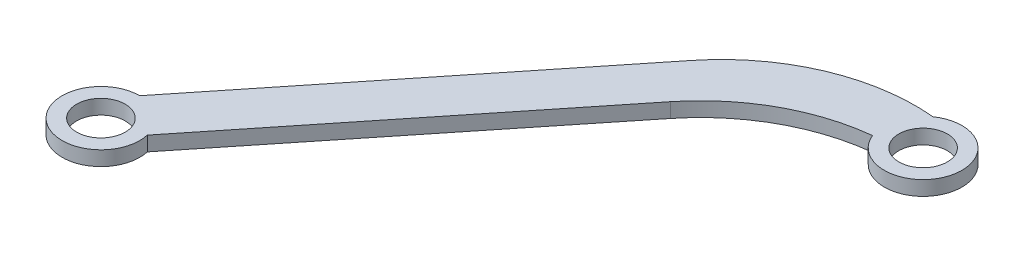
from build123d import *

# Parameters (mm, degrees)
EXTRUDE_1_DEPTH     = 3
FILLET_1_R          = 40
SKETCH_2_R          = 5
CUT_EXTRUDE_1_DEPTH = 5
SKETCH_3_R          = 5
CUT_EXTRUDE_2_DEPTH = 5


with BuildPart() as part:
    # 草图1 → 凸台-拉伸1 (new body)
    with BuildSketch(Plane(origin=(0, 0, 0), x_dir=(1, 0, 0), z_dir=(0, 1, 0))):
        with BuildLine():
            Line((-23.136391963, 12.14008034), (-4.550043431, 6.580053554))
            ThreePointArc((-4.550043431, 6.580053554), (7.664409986, -2.292775515), (-7.416012825, -3.000458929))
            Line((-7.416012825, -3.000458929), (-19.543612326, 0.627460668))
            Line((-19.543612326, 0.627460668), (-82.193752502, -77.622539332))
            ThreePointArc((-82.193752502, -77.622539332), (-95, -85.61753733), (-90, -71.372539332))
            Line((-90, -71.372539332), (-23.136391963, 12.14008034))
        make_face()
    extrude(amount=EXTRUDE_1_DEPTH)

    # 圆角1
    # the kernel refuses this fillet: 40 mm, written as the material it adds along each edge
    with BuildSketch(Plane(origin=(-19.543612326, 0, -0.627460668), x_dir=(0.9580512482944434, 0, 0.2865969393441921), z_dir=(0, 1, 0))) as fillet_1_piece_1:
        with BuildLine():
            CenterArc((28.245446023, -36.838167986), FILLET_1_R, 112.934019548, 45.038121995)
            Line((-8.834618101, -21.835873341), (-9.576219383, -21.535827448))
            Line((-9.576219383, -21.535827448), (-0.741601282, 0.300045893))
            Line((-0.741601282, 0.300045893), (0, 0.8))
            ThreePointArc((0, 0.8), (6.329306247, 0.8), (12.346875823, 0.73676336))
            Line((12.346875823, 0.73676336), (12.658612494, 0))
        make_face()
    extrude(amount=3)
    # the kernel refuses this fillet: 40 mm, written as the material it takes off along each edge
    with BuildSketch(Plane(origin=(-23.136391963, -65.299644029, -12.14008034), x_dir=(0.9580512482944434, 0, 0.2865969393441925), z_dir=(0, 1, 0))) as fillet_1_2_piece_1:
        with BuildLine():
            CenterArc((27.283619124, -39.215444523), FILLET_1_R, 101.366634115, 56.605507428)
            Line((-9.796444999, -24.213149878), (-10.538046282, -23.913103985))
            Line((-10.538046282, -23.913103985), (-0.741601282, 0.300045893))
            Line((-0.741601282, 0.300045893), (0, 0.8))
            ThreePointArc((0, 0.8), (9.700080536, 0.8), (19.24249191, 0.78430889))
            Line((19.24249191, 0.78430889), (19.400161071, 0))
        make_face()
    extrude(amount=133.599288058, mode=Mode.SUBTRACT)

    # 草图2 → 切除-拉伸1 (cut)
    with BuildSketch(Plane(origin=(0, 3, 0), x_dir=(1, 0, 0), z_dir=(0, 1, 0))):
        with Locations(Location((-90, -79.372539332, 0), (0, 0, 270))):
            Circle(SKETCH_2_R)
    extrude(amount=-CUT_EXTRUDE_1_DEPTH, mode=Mode.SUBTRACT)

    # 草图3 → 切除-拉伸2 (cut)
    with BuildSketch(Plane(origin=(0, 3, 0), x_dir=(1, 0, 0), z_dir=(0, 1, 0))):
        with Locations(Location((0, 0, 0), (0, 0, 270))):
            Circle(SKETCH_3_R)
    extrude(amount=-CUT_EXTRUDE_2_DEPTH, mode=Mode.SUBTRACT)


solid = part.part
